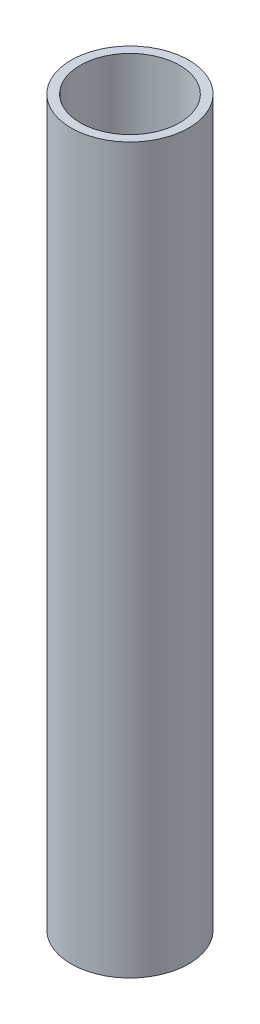
from build123d import *

# Parameters (mm, degrees)
SKETCH_1_R      = 19.5
SKETCH_1_R_2    = 16.5
EXTRUDE_1_DEPTH = 240


with BuildPart() as part:
    # 草图1 → 凸台-拉伸1 (new body)
    with BuildSketch(Plane(origin=(0, 0, 0), x_dir=(1, 0, 0), z_dir=(0, 1, 0))):
        Circle(SKETCH_1_R)
        Circle(SKETCH_1_R_2, mode=Mode.SUBTRACT)
    extrude(amount=EXTRUDE_1_DEPTH)


solid = part.part
